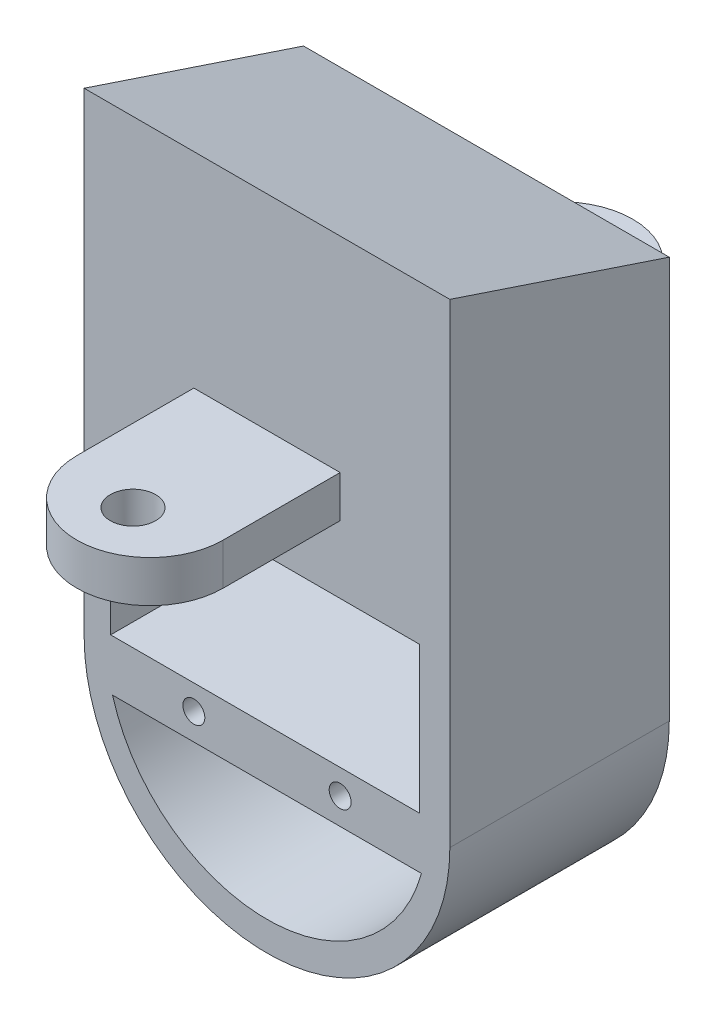
from build123d import *

# Parameters (mm, degrees)
SKETCH1_W                = 25
SKETCH1_H                = 45
BOSS_EXTRUDE1_DEPTH      = 15
BOSS_EXTRUDE2_START      = -10.05
BOSS_EXTRUDE2_DEPTH      = 20.1
CUT_EXTRUDE1_DEPTH       = 30.79093822
CUT_EXTRUDE1_DEPTH_BACK  = 30.79093822
CUT_EXTRUDE3_DEPTH       = 30.79093822
CUT_EXTRUDE3_DEPTH_BACK  = 30.79093822
CUT_EXTRUDE7_DEPTH       = 30.79093822
CUT_EXTRUDE9_OUTLINE_W   = 21.12
CUT_EXTRUDE9_OUTLINE_H   = 10
CUT_EXTRUDE9_OUTLINE_W_2 = 21.100995898
CUT_EXTRUDE9_OUTLINE_H_2 = 2.85
CUT_EXTRUDE9_DEPTH       = 15
SKETCH8_W                = 7
SKETCH8_H                = 2.5
BOSS_EXTRUDE3_DEPTH      = 10
CUT_EXTRUDE11_DEPTH      = 30.79093822
CUT_EXTRUDE11_DEPTH_BACK = 30.79093822
CUT_EXTRUDE12_DEPTH      = 30.79093822
CUT_EXTRUDE12_DEPTH_BACK = 30.79093822
SKETCH10_R               = 1.6
CUT_EXTRUDE14_DEPTH      = 30.79093822
CUT_EXTRUDE14_DEPTH_BACK = 30.79093822
SKETCH12_R               = 0.75
CUT_EXTRUDE15_DEPTH      = 30.79093822
CUT_EXTRUDE15_DEPTH_BACK = 30.79093822
SKETCH15_W               = 15.416816506
SKETCH15_H               = 10.763431908
BOSS_EXTRUDE5_START      = 3
SKETCH16_W               = 21.100995898
SKETCH16_H               = 2.85
BOSS_EXTRUDE5_DEPTH      = 13
CUT_EXTRUDE17_DEPTH      = 30.79093822
CUT_EXTRUDE17_DEPTH_BACK = 30.79093822
SKETCH17_R               = 1.55
BOSS_EXTRUDE6_START      = 13
SKETCH18_W               = 21.100995898
SKETCH18_H               = 2.85
BOSS_EXTRUDE6_DEPTH      = 15
CUT_EXTRUDE18_DEPTH      = 39.032880511
CUT_EXTRUDE18_DEPTH_BACK = 39.032880511
SKETCH19_R               = 1.55


# Read off the part's stored shape, not the designer's step: Cut-Extrude9
with BuildPart() as part:
    # Sketch1 → Boss-Extrude1 (new body)
    with BuildSketch(Plane.XY):
        Rectangle(SKETCH1_W, SKETCH1_H)
    extrude(amount=BOSS_EXTRUDE1_DEPTH)

    # Sketch2 → Boss-Extrude2 (add)
    with BuildSketch(Plane(origin=(0, 0, 0), x_dir=(0, 0, -1), z_dir=(1, 0, 0)).offset(BOSS_EXTRUDE2_START)):
        Polygon((-15, 22.5), (-15, 21.775067879), (0, 22.5), align=None)
    extrude(amount=BOSS_EXTRUDE2_DEPTH)

    # Sketch3 → Cut-Extrude1 (cut, two sides: drawn at the far end of the back side and taken through both)
    with BuildSketch(Plane(origin=(0, 0, 0), x_dir=(0, 0, -1), z_dir=(1, 0, 0)).offset(-CUT_EXTRUDE1_DEPTH_BACK)):
        Polygon((-15, 22.5), (0, 17.5), (5.857225601, 19.69853849), (5.857225601, 28.456051758), (-15, 27.780768739), align=None)
    extrude(amount=CUT_EXTRUDE1_DEPTH + CUT_EXTRUDE1_DEPTH_BACK, mode=Mode.SUBTRACT)

    # Sketch4 → Cut-Extrude3 (cut, two sides: drawn at the far end of the back side and taken through both)
    with BuildSketch(Plane.XY.offset(-CUT_EXTRUDE3_DEPTH_BACK)):
        with BuildLine():
            Line((-17.124140969, -24.670147455), (0, -24.921234566))
            Line((0, -24.921234566), (0, -22.455047029))
            ThreePointArc((0, -22.455047029), (-8.838834765, -18.793881794), (-12.5, -9.955047029))
            Line((-12.5, -9.955047029), (-17.124140969, -24.670147455))
        make_face()
        with BuildLine():
            Line((0, -22.455047029), (0, -24.921234566))
            Line((0, -24.921234566), (18.053725517, -25.185951949))
            Line((18.053725517, -25.185951949), (12.5, -9.955047029))
            ThreePointArc((12.5, -9.955047029), (8.838834765, -18.793881794), (0, -22.455047029))
        make_face()
    extrude(amount=CUT_EXTRUDE3_DEPTH + CUT_EXTRUDE3_DEPTH_BACK, mode=Mode.SUBTRACT)

    # Sketch5 → Cut-Extrude7 (cut, through all)
    with BuildSketch(Plane.XY):
        with BuildLine():
            Line((10.560989946, -12.455047029), (-10.560989946, -12.455047029))
            ThreePointArc((-10.560989946, -12.455047029), (0, -20.455047029), (10.560989946, -12.455047029))
        make_face()
    extrude(amount=CUT_EXTRUDE7_DEPTH, mode=Mode.SUBTRACT)

    # Cut-Extrude9 outline → Cut-Extrude9 (cut)
    with BuildSketch(Plane.XY):
        with Locations((-0.129474346, -3.955047029)):
            Rectangle(CUT_EXTRUDE9_OUTLINE_W, CUT_EXTRUDE9_OUTLINE_H)
        with Locations((-0.010491997, 7.075)):
            Rectangle(CUT_EXTRUDE9_OUTLINE_W_2, CUT_EXTRUDE9_OUTLINE_H_2)
    extrude(amount=CUT_EXTRUDE9_DEPTH, mode=Mode.SUBTRACT)

    # Sketch8 → Boss-Extrude3 (add)
    with BuildSketch(Plane.XY):
        with Locations((0, 4.4)):
            Rectangle(SKETCH8_W, SKETCH8_H)
    extrude(amount=-BOSS_EXTRUDE3_DEPTH)

    # Sketch9 → Cut-Extrude11 (cut, two sides: drawn at the far end of the back side and taken through both)
    with BuildSketch(Plane(origin=(0, 0, 0), x_dir=(1, 0, 0), z_dir=(0, 1, 0)).offset(-CUT_EXTRUDE11_DEPTH_BACK)):
        with BuildLine():
            Line((-5.143587348, 10.809031185), (-3.492186712, 6.389631225))
            ThreePointArc((-3.492186712, 6.389631225), (0, 9.881817937), (3.492186712, 6.389631225))
            ThreePointArc((3.492186712, 6.389631225), (3.488488867, 6.228965567), (3.477403165, 6.068640163))
            Line((3.477403165, 6.068640163), (6.889064643, 10.549066481))
            Line((6.889064643, 10.549066481), (-5.143587348, 10.809031185))
        make_face()
    extrude(amount=CUT_EXTRUDE11_DEPTH + CUT_EXTRUDE11_DEPTH_BACK, mode=Mode.SUBTRACT)

    # Sketch10 → Cut-Extrude12 (cut, two sides: drawn at the far end of the back side and taken through both)
    with BuildSketch(Plane(origin=(0, 0, 0), x_dir=(1, 0, 0), z_dir=(0, 1, 0)).offset(-CUT_EXTRUDE12_DEPTH_BACK)):
        with Locations((0, 6.891628676)):
            Circle(SKETCH10_R)
        with BuildLine():
            ThreePointArc((1.6, 6.891628676), (0, 5.291628676), (-1.6, 6.891628676))
            Line((-1.6, 6.891628676), (-1.6, 0))
            Line((-1.6, 0), (1.6, 0))
            Line((1.6, 0), (1.6, 6.891628676))
        make_face()
    extrude(amount=CUT_EXTRUDE12_DEPTH + CUT_EXTRUDE12_DEPTH_BACK, mode=Mode.SUBTRACT)

    # Sketch12 → Cut-Extrude14 (cut, two sides: drawn at the far end of the back side and taken through both)
    with BuildSketch(Plane.XY.offset(-CUT_EXTRUDE14_DEPTH_BACK)):
        with Locations((-5, -10.646832198)):
            Circle(SKETCH12_R)
        with Locations((5, -10.646832198)):
            Circle(SKETCH12_R)
    extrude(amount=CUT_EXTRUDE14_DEPTH + CUT_EXTRUDE14_DEPTH_BACK, mode=Mode.SUBTRACT)

    # Sketch15 → Cut-Extrude15 (cut, two sides: drawn at the far end of the back side and taken through both)
    with BuildSketch(Plane(origin=(0, 0, 0), x_dir=(1, 0, 0), z_dir=(0, 1, 0)).offset(-CUT_EXTRUDE15_DEPTH_BACK)):
        with Locations((0.052797317, 5.381715954)):
            Rectangle(SKETCH15_W, SKETCH15_H)
    extrude(amount=CUT_EXTRUDE15_DEPTH + CUT_EXTRUDE15_DEPTH_BACK, mode=Mode.SUBTRACT)

    # Sketch16 → Boss-Extrude5 (add)
    with BuildSketch(Plane.XY.offset(BOSS_EXTRUDE5_START)):
        with Locations((-0.010491997, 7.075)):
            Rectangle(SKETCH16_W, SKETCH16_H)
    extrude(amount=-BOSS_EXTRUDE5_DEPTH)

    # Sketch17 → Cut-Extrude17 (cut, two sides: drawn at the far end of the back side and taken through both)
    with BuildSketch(Plane(origin=(0, 0, 0), x_dir=(1, 0, 0), z_dir=(0, 1, 0)).offset(-CUT_EXTRUDE17_DEPTH_BACK)):
        with Locations(Location((0, 6.400921521, 0), (0, 0, 270))):
            Circle(SKETCH17_R)
        with BuildLine():
            Line((5, 5), (5, 0))
            Line((5, 0), (12.5, 0))
            Line((12.5, 0), (12.436231279, 14.247241291))
            Line((12.436231279, 14.247241291), (-13.710360946, 14.247241291))
            Line((-13.710360946, 14.247241291), (-13.710360946, 0))
            Line((-13.710360946, 0), (-5, 0))
            Line((-5, 0), (-5, 5))
            ThreePointArc((-5, 5), (-3.535533906, 8.535533906), (0, 10))
            ThreePointArc((0, 10), (3.535533906, 8.535533906), (5, 5))
        make_face()
    extrude(amount=CUT_EXTRUDE17_DEPTH + CUT_EXTRUDE17_DEPTH_BACK, mode=Mode.SUBTRACT)

    # Sketch18 → Boss-Extrude6 (add)
    with BuildSketch(Plane.XY.offset(BOSS_EXTRUDE6_START)):
        with Locations((-0.010491997, 7.075)):
            Rectangle(SKETCH18_W, SKETCH18_H)
    extrude(amount=BOSS_EXTRUDE6_DEPTH)

    # Sketch19 → Cut-Extrude18 (cut, two sides: drawn at the far end of the back side and taken through both)
    with BuildSketch(Plane(origin=(0, 0, 0), x_dir=(1, 0, 0), z_dir=(0, 1, 0)).offset(-CUT_EXTRUDE18_DEPTH_BACK)):
        with Locations(Location((0, -24.160628435, 0), (0, 0, 270))):
            Circle(SKETCH19_R)
        with BuildLine():
            Line((-5, -23), (-5, -15))
            Line((-5, -15), (-19.938016683, -15))
            Line((-19.938016683, -15), (-19.938016683, -28.423127273))
            Line((-19.938016683, -28.423127273), (20.151320265, -28.423127273))
            Line((20.151320265, -28.423127273), (20.151320265, -15))
            Line((20.151320265, -15), (5, -15))
            Line((5, -15), (5, -23))
            ThreePointArc((5, -23), (0, -28), (-5, -23))
        make_face()
    extrude(amount=CUT_EXTRUDE18_DEPTH + CUT_EXTRUDE18_DEPTH_BACK, mode=Mode.SUBTRACT)


solid = part.part
